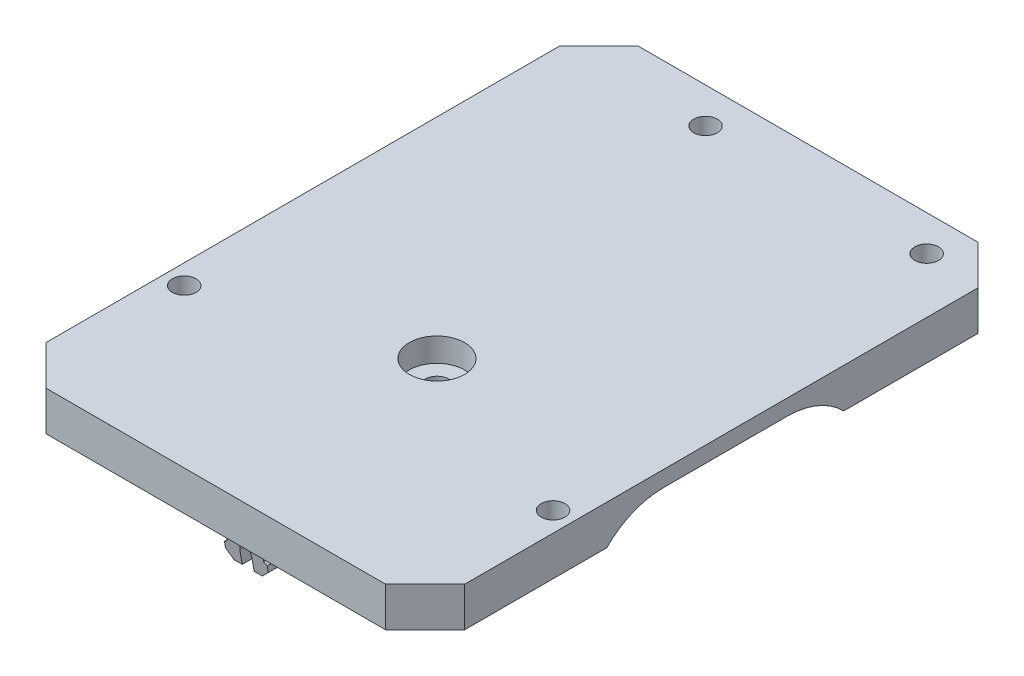
from build123d import *
from OCP.BRepFilletAPI import BRepFilletAPI_MakeChamfer

# Parameters (mm, degrees)
SKETCH1_W           = 53
SKETCH1_H           = 5
SKETCH1_H_2         = 70
SKETCH1_R           = 1.5
BOSS_EXTRUDE1_DEPTH = 5
SKETCH2_R           = 1.5
CUT_EXTRUDE1_DEPTH  = 10
SKETCH3_R           = 3.5
CUT_EXTRUDE2_DEPTH  = 3
SKETCH2_3_W         = 2.25
SKETCH2_3_H         = 15
BOSS_EXTRUDE2_DEPTH = 6
CUT_EXTRUDE3_DEPTH  = 79.961729873
CHAMFER2_SIZE       = 0.75
CHAMFER2_SIZE_2     = 4.253461365
CHAMFER3_SIZE       = 1.1
CHAMFER3_SIZE_2     = 6.238410002
SKETCH5_W           = 15
SKETCH5_H           = 30
CUT_EXTRUDE4_DEPTH  = 3
FILLET1_R           = 10
CHAMFER4_SIZE       = 5


# Some blends are built 0.0001 mm under size
with BuildPart() as part:
    # Sketch1 → Boss-Extrude1 (new body)
    # profile 1 of 2: a face of its own
    with BuildSketch(Plane(origin=(0, 0, 0), x_dir=(1, 0, 0), z_dir=(0, 1, 0))):
        with Locations((5.35835502, -40.562169312)):
            Rectangle(SKETCH1_W, SKETCH1_H)
    # profile 2 of 2: a face of its own
    with BuildSketch(Plane(origin=(0, 0, 0), x_dir=(1, 0, 0), z_dir=(0, 1, 0))):
        with Locations((5.35835502, -3.062169312)):
            Rectangle(SKETCH1_W, SKETCH1_H_2)
        with Locations(Location((29.35835502, -24.362169312, 0), (0, 0, 270))):
            Circle(SKETCH1_R, mode=Mode.SUBTRACT)
        with Locations(Location((24.85835502, 27.437830688, 0), (0, 0, 270))):
            Circle(SKETCH1_R, mode=Mode.SUBTRACT)
        with Locations(Location((-3.14164498, 27.437830688, 0), (0, 0, 270))):
            Circle(SKETCH1_R, mode=Mode.SUBTRACT)
        with Locations(Location((-18.64164498, -23.062169312, 0), (0, 0, 270))):
            Circle(SKETCH1_R, mode=Mode.SUBTRACT)
    extrude(amount=BOSS_EXTRUDE1_DEPTH)

    # Sketch2 → Cut-Extrude1 (cut)
    with BuildSketch(Plane.XZ):
        with Locations(Location((5.35835502, 15.062169312, 0), (0, 0, 270))):
            Circle(SKETCH2_R)
    extrude(amount=-CUT_EXTRUDE1_DEPTH, mode=Mode.SUBTRACT)

    # Sketch3 → Cut-Extrude2 (cut)
    with BuildSketch(Plane(origin=(0, 5, 0), x_dir=(1, 0, 0), z_dir=(0, 1, 0))):
        with Locations(Location((5.35835502, -15.062169312, 0), (0, 0, 270))):
            Circle(SKETCH3_R)
    extrude(amount=-CUT_EXTRUDE2_DEPTH, mode=Mode.SUBTRACT)

    # Sketch2<3> → Boss-Extrude2 (add)
    with BuildSketch(Plane.XZ):
        with Locations((3.48335502, -2.437830688)):
            Rectangle(SKETCH2_3_W, SKETCH2_3_H)
        with Locations((7.23335502, -2.437830688)):
            Rectangle(SKETCH2_3_W, SKETCH2_3_H)
        with Locations((7.23335502, 32.562169312)):
            Rectangle(SKETCH2_3_W, SKETCH2_3_H)
        with Locations((3.48335502, 32.562169312)):
            Rectangle(SKETCH2_3_W, SKETCH2_3_H)
    extrude(amount=BOSS_EXTRUDE2_DEPTH)

    # Sketch4 → Cut-Extrude3 (cut, through all)
    with BuildSketch(Plane.XY.offset(40.062169312)):
        Polygon((8.35835502, -4.5), (8.35835502, 0), (7.65835502, 0), (7.65835502, -4), (8.05835502, -4.285714286), (8.05835502, -5.1), (7.15835502, -6), (8.35835502, -6), (8.35835502, -4.8), align=None)
        Polygon((2.65835502, -4.285714286), (3.05835502, -4), (3.05835502, 0), (2.35835502, 0), (2.35835502, -4.5), (2.35835502, -4.8), (2.35835502, -6), (3.55835502, -6), (2.65835502, -5.1), align=None)
    extrude(amount=-CUT_EXTRUDE3_DEPTH, mode=Mode.SUBTRACT)

    # Chamfer2
    chamfer2_edges_1 = [part.edges().sort_by_distance(p)[0] for p in [
        (4.60835502, 0, -2.437830688),
    ]]
    chamfer2_side_1 = [part.faces().sort_by_distance(p)[0] for p in [
        (4.62335502, 0, -2.437830688),
    ]]
    chamfer2_edges_2 = [part.edges().sort_by_distance(p)[0] for p in [
        (6.10835502, 0, -2.437830688),
    ]]
    chamfer2_side_2 = [part.faces().sort_by_distance(p)[0] for p in [
        (6.09335502, 0, -2.437830688),
    ]]
    chamfer2_edges_3 = [part.edges().sort_by_distance(p)[0] for p in [
        (6.10835502, 0, 32.562169312),
    ]]
    chamfer2_side_3 = [part.faces().sort_by_distance(p)[0] for p in [
        (6.09335502, 0, 32.562169312),
    ]]
    chamfer2_edges_4 = [part.edges().sort_by_distance(p)[0] for p in [
        (4.60835502, 0, 32.562169312),
    ]]
    chamfer2_side_4 = [part.faces().sort_by_distance(p)[0] for p in [
        (4.62335502, 0, 32.562169312),
    ]]
    chamfer2 = BRepFilletAPI_MakeChamfer(part.part.solid().wrapped)
    for e in chamfer2_edges_1:
        chamfer2.Add(CHAMFER2_SIZE - 0.0001, CHAMFER2_SIZE_2 - 0.0001, e.wrapped, chamfer2_side_1[0].wrapped)
    for e in chamfer2_edges_2:
        chamfer2.Add(CHAMFER2_SIZE - 0.0001, CHAMFER2_SIZE_2 - 0.0001, e.wrapped, chamfer2_side_2[0].wrapped)
    for e in chamfer2_edges_3:
        chamfer2.Add(CHAMFER2_SIZE - 0.0001, CHAMFER2_SIZE_2 - 0.0001, e.wrapped, chamfer2_side_3[0].wrapped)
    for e in chamfer2_edges_4:
        chamfer2.Add(CHAMFER2_SIZE - 0.0001, CHAMFER2_SIZE_2 - 0.0001, e.wrapped, chamfer2_side_4[0].wrapped)
    add(Compound.cast(chamfer2.Shape()), mode=Mode.REPLACE)  # a hair under: the kernel refuses the full size

    # Chamfer3
    # the kernel refuses this chamfer: 6.238410002, 1.1 mm, written as the material it takes off along each edge
    with BuildSketch(Plane(origin=(20.819105437, -6, 40.062169312), x_dir=(0, -0.210138760767435, -0.977671571246258), z_dir=(-1, 0, 0))) as chamfer3_piece_1_section:
        Polygon((CHAMFER3_SIZE * 0.977671571246, -CHAMFER3_SIZE * 0.210138760767), (-CHAMFER3_SIZE_2 * 0.210138760753, -CHAMFER3_SIZE_2 * 0.97767157118), (0, 0), align=None)
    chamfer3_piece_1 = extrude(amount=33.471500834, mode=Mode.PRIVATE)
    chamfer3_piece_1 = split(chamfer3_piece_1, bisect_by=Plane(origin=(4.08335502, 0, 39.758425896), z_dir=(0, -1, 0)), keep=Keep.TOP, mode=Mode.PRIVATE)
    add(chamfer3_piece_1, mode=Mode.SUBTRACT)
    with BuildSketch(Plane(origin=(-12.652395397, -6, 25.062169312), x_dir=(0, -0.210138760767435, 0.977671571246258), z_dir=(1, 0, 0))) as chamfer3_piece_2_section:
        Polygon((CHAMFER3_SIZE * 0.977671571246, -CHAMFER3_SIZE * 0.210138760767), (-CHAMFER3_SIZE_2 * 0.210138760753, -CHAMFER3_SIZE_2 * 0.97767157118), (0, 0), align=None)
    chamfer3_piece_2 = extrude(amount=33.471500834, mode=Mode.PRIVATE)
    chamfer3_piece_2 = split(chamfer3_piece_2, bisect_by=Plane(origin=(4.08335502, 0, 25.365912729), z_dir=(0, -1, 0)), keep=Keep.TOP, mode=Mode.PRIVATE)
    add(chamfer3_piece_2, mode=Mode.SUBTRACT)
    with BuildSketch(Plane(origin=(23.369105437, -6, 40.062169312), x_dir=(0, -0.210138760767435, -0.977671571246258), z_dir=(-1, 0, 0))) as chamfer3_piece_3_section:
        Polygon((CHAMFER3_SIZE * 0.977671571246, -CHAMFER3_SIZE * 0.210138760767), (-CHAMFER3_SIZE_2 * 0.210138760753, -CHAMFER3_SIZE_2 * 0.97767157118), (0, 0), align=None)
    chamfer3_piece_3 = extrude(amount=33.471500834, mode=Mode.PRIVATE)
    chamfer3_piece_3 = split(chamfer3_piece_3, bisect_by=Plane(origin=(6.63335502, 0, 39.758425896), z_dir=(0, -1, 0)), keep=Keep.TOP, mode=Mode.PRIVATE)
    add(chamfer3_piece_3, mode=Mode.SUBTRACT)
    with BuildSketch(Plane(origin=(-10.102395397, -6, 25.062169312), x_dir=(0, -0.210138760767435, 0.977671571246258), z_dir=(1, 0, 0))) as chamfer3_piece_4_section:
        Polygon((CHAMFER3_SIZE * 0.977671571246, -CHAMFER3_SIZE * 0.210138760767), (-CHAMFER3_SIZE_2 * 0.210138760753, -CHAMFER3_SIZE_2 * 0.97767157118), (0, 0), align=None)
    chamfer3_piece_4 = extrude(amount=33.471500834, mode=Mode.PRIVATE)
    chamfer3_piece_4 = split(chamfer3_piece_4, bisect_by=Plane(origin=(6.63335502, 0, 25.365912729), z_dir=(0, -1, 0)), keep=Keep.TOP, mode=Mode.PRIVATE)
    add(chamfer3_piece_4, mode=Mode.SUBTRACT)
    with BuildSketch(Plane(origin=(23.369105437, -6, 5.062169312), x_dir=(0, -0.21013876076743537, -0.9776715712462578), z_dir=(-1, 0, 0))) as chamfer3_piece_5_section:
        Polygon((CHAMFER3_SIZE * 0.977671571246, -CHAMFER3_SIZE * 0.210138760767), (-CHAMFER3_SIZE_2 * 0.210138760753, -CHAMFER3_SIZE_2 * 0.97767157118), (0, 0), align=None)
    chamfer3_piece_5 = extrude(amount=33.471500834, mode=Mode.PRIVATE)
    chamfer3_piece_5 = split(chamfer3_piece_5, bisect_by=Plane(origin=(6.63335502, 0, 4.758425896), z_dir=(0, -1, 0)), keep=Keep.TOP, mode=Mode.PRIVATE)
    add(chamfer3_piece_5, mode=Mode.SUBTRACT)
    with BuildSketch(Plane(origin=(-10.102395397, -6, -9.937830688), x_dir=(0, -0.21013876076743562, 0.9776715712462578), z_dir=(1, 0, 0))) as chamfer3_piece_6_section:
        Polygon((CHAMFER3_SIZE * 0.977671571246, -CHAMFER3_SIZE * 0.210138760767), (-CHAMFER3_SIZE_2 * 0.210138760753, -CHAMFER3_SIZE_2 * 0.97767157118), (0, 0), align=None)
    chamfer3_piece_6 = extrude(amount=33.471500834, mode=Mode.PRIVATE)
    chamfer3_piece_6 = split(chamfer3_piece_6, bisect_by=Plane(origin=(6.63335502, 0, -9.634087271), z_dir=(0, -1, 0)), keep=Keep.TOP, mode=Mode.PRIVATE)
    add(chamfer3_piece_6, mode=Mode.SUBTRACT)
    with BuildSketch(Plane(origin=(20.819105437, -6, 5.062169312), x_dir=(0, -0.21013876076743546, -0.9776715712462578), z_dir=(-1, 0, 0))) as chamfer3_piece_7_section:
        Polygon((CHAMFER3_SIZE * 0.977671571246, -CHAMFER3_SIZE * 0.210138760767), (-CHAMFER3_SIZE_2 * 0.210138760753, -CHAMFER3_SIZE_2 * 0.97767157118), (0, 0), align=None)
    chamfer3_piece_7 = extrude(amount=33.471500834, mode=Mode.PRIVATE)
    chamfer3_piece_7 = split(chamfer3_piece_7, bisect_by=Plane(origin=(4.08335502, 0, 4.758425896), z_dir=(0, -1, 0)), keep=Keep.TOP, mode=Mode.PRIVATE)
    add(chamfer3_piece_7, mode=Mode.SUBTRACT)
    with BuildSketch(Plane(origin=(-12.652395397, -6, -9.937830688), x_dir=(-1.5437276286848704e-15, -0.21013876076743562, 0.9776715712462578), z_dir=(1, 0, 0))) as chamfer3_piece_8_section:
        Polygon((CHAMFER3_SIZE * 0.977671571246, -CHAMFER3_SIZE * 0.210138760767), (-CHAMFER3_SIZE_2 * 0.210138760753, -CHAMFER3_SIZE_2 * 0.97767157118), (0, 0), align=None)
    chamfer3_piece_8 = extrude(amount=33.471500834, mode=Mode.PRIVATE)
    chamfer3_piece_8 = split(chamfer3_piece_8, bisect_by=Plane(origin=(4.08335502, 0, -9.634087271), z_dir=(0, -1, 0)), keep=Keep.TOP, mode=Mode.PRIVATE)
    add(chamfer3_piece_8, mode=Mode.SUBTRACT)

    # Sketch5 → Cut-Extrude4 (cut)
    with BuildSketch(Plane.XZ):
        with Locations((24.35835502, 5.062169312)):
            Rectangle(SKETCH5_W, SKETCH5_H)
        with Locations((-13.64164498, 5.062169312)):
            Rectangle(SKETCH5_W, SKETCH5_H)
    extrude(amount=-CUT_EXTRUDE4_DEPTH, mode=Mode.SUBTRACT)

    # Fillet1
    # the kernel refuses this fillet: 10 mm, written as the material it adds along each edge
    with BuildSketch(Plane(origin=(31.85835502, 3, -9.937830688), x_dir=(0, -1, 0), z_dir=(-1, 0, 0))) as fillet1_piece_1:
        with BuildLine():
            CenterArc((10, 7.141428429), FILLET1_R, 180, 45.572995999)
            Line((0, 7.141428429), (0, 0))
            Line((0, 0), (3, 0))
        make_face()
    extrude(amount=32.853571071)
    with BuildSketch(Plane(origin=(16.85835502, 3, 20.062169312), x_dir=(0, -1, 0), z_dir=(1, 0, 0))) as fillet1_piece_2:
        with BuildLine():
            CenterArc((10, 7.141428429), FILLET1_R, 180, 45.572995999)
            Line((0, 7.141428429), (0, 0))
            Line((0, 0), (3, 0))
        make_face()
    extrude(amount=15)
    with BuildSketch(Plane(origin=(-6.14164498, 3, 20.062169312), x_dir=(0, -1, 0), z_dir=(-1, 0, 0))) as fillet1_piece_3:
        with BuildLine():
            CenterArc((10, -7.141428429), FILLET1_R, 134.427004001, 45.572995999)
            Line((0, -7.141428429), (0, 0))
            Line((0, 0), (3, 0))
        make_face()
    extrude(amount=15)
    with BuildSketch(Plane(origin=(-21.14164498, 3, -9.937830688), x_dir=(0, -1, 0), z_dir=(1, 0, 0))) as fillet1_piece_4:
        with BuildLine():
            CenterArc((10, -7.141428429), FILLET1_R, 134.427004001, 45.572995999)
            Line((0, -7.141428429), (0, 0))
            Line((0, 0), (3, 0))
        make_face()
    extrude(amount=32.853571071)
    with BuildSketch(Plane(origin=(-6.14164498, 3, -27.791401759), x_dir=(0, -1, 0), z_dir=(0, 0, 1))) as fillet1_piece_5:
        with BuildLine():
            CenterArc((10, -7.141428429), FILLET1_R, 134.427004001, 45.572995999)
            Line((0, -7.141428429), (0, 0))
            Line((0, 0), (3, 0))
        make_face()
    extrude(amount=65.707142143)
    with BuildSketch(Plane(origin=(16.85835502, 3, -9.937830688), x_dir=(0, -1, 0), z_dir=(0, 0, 1))) as fillet1_piece_6:
        with BuildLine():
            CenterArc((10, 7.141428429), FILLET1_R, 180, 45.572995999)
            Line((0, 7.141428429), (0, 0))
            Line((0, 0), (3, 0))
        make_face()
    extrude(amount=47.853571071)

    # Chamfer4
    chamfer4_edges = [part.edges().sort_by_distance(p)[0] for p in [
        (31.85835502, 2.5, 43.062169312),
        (-21.14164498, 2.5, 43.062169312),
        (-21.14164498, 2.5, -31.937830688),
        (31.85835502, 2.5, -31.937830688),
    ]]
    chamfer(chamfer4_edges, length=CHAMFER4_SIZE)


solid = part.part
